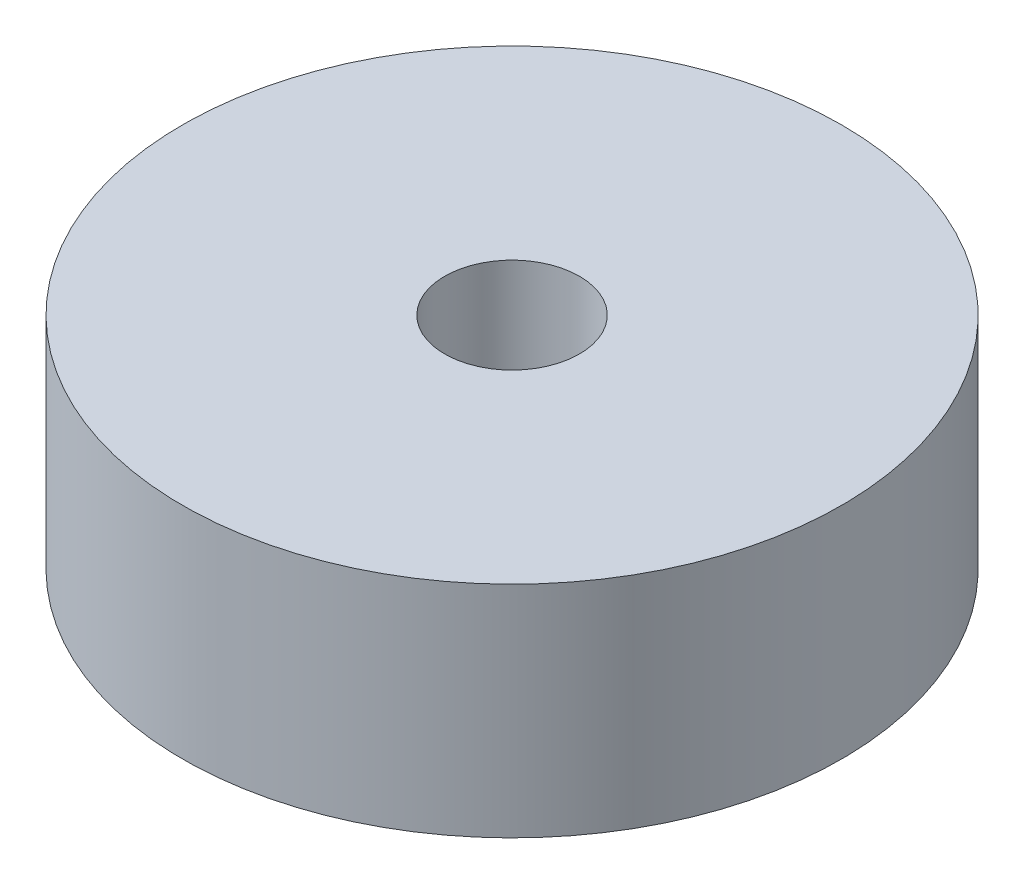
from build123d import *

# Parameters (mm, degrees)
SKETCH2_R           = 28.575
SKETCH2_R_2         = 5.842
BOSS_EXTRUDE1_DEPTH = 19.05


with BuildPart() as part:
    # Sketch2 → Boss-Extrude1 (new body)
    with BuildSketch(Plane(origin=(0, 0, 0), x_dir=(1, 0, 0), z_dir=(0, 1, 0))):
        Circle(SKETCH2_R)
        Circle(SKETCH2_R_2, mode=Mode.SUBTRACT)
    extrude(amount=BOSS_EXTRUDE1_DEPTH)


solid = part.part
